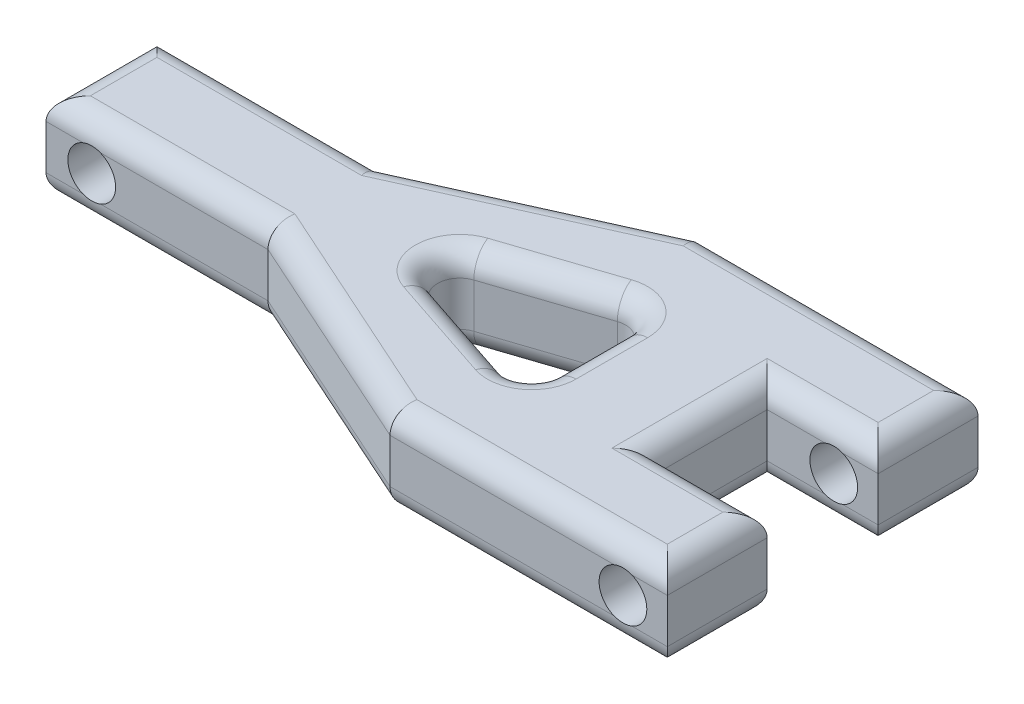
from build123d import *

# Parameters (mm, degrees)
SKETCH1_W           = 65
SKETCH1_H           = 28
BOSS_EXTRUDE1_DEPTH = 8
SKETCH2_W           = 10
SKETCH2_H           = 10
CUT_EXTRUDE1_DEPTH  = 10
SKETCH3_R           = 2.15
CUT_EXTRUDE2_DEPTH  = 48.899263129
SKETCH5_W           = 20.008392886
SKETCH5_H           = 9
CUT_EXTRUDE4_DEPTH  = 42.488060591
FILLET1_R           = 2
SKETCH8_R           = 2.15
CUT_EXTRUDE5_DEPTH  = 44.258980729
CUT_EXTRUDE6_DEPTH  = 10
FILLET2_R           = 2


with BuildPart() as part:
    # Sketch1 → Boss-Extrude1 (new body)
    with BuildSketch(Plane(origin=(0, 0, 0), x_dir=(1, 0, 0), z_dir=(0, 1, 0))):
        with Locations((-5.530769231, -0.523076923)):
            Rectangle(SKETCH1_W, SKETCH1_H)
    extrude(amount=BOSS_EXTRUDE1_DEPTH)

    # Sketch2 → Cut-Extrude1 (cut)
    with BuildSketch(Plane(origin=(0, 8, 0), x_dir=(1, 0, 0), z_dir=(0, 1, 0))):
        with Locations((21.969230769, -0.523076923)):
            Rectangle(SKETCH2_W, SKETCH2_H)
    extrude(amount=-CUT_EXTRUDE1_DEPTH, mode=Mode.SUBTRACT)

    # Sketch3 → Cut-Extrude2 (cut, through all)
    with BuildSketch(Plane.XY.offset(14.523076923)):
        with Locations((22.969230769, 4)):
            Circle(SKETCH3_R)
    extrude(amount=-CUT_EXTRUDE2_DEPTH, mode=Mode.SUBTRACT)

    # Sketch5 → Cut-Extrude4 (cut, through all)
    with BuildSketch(Plane(origin=(0, 8, 0), x_dir=(1, 0, 0), z_dir=(0, 1, 0))):
        with Locations((-28.026572788, 8.976923077)):
            Rectangle(SKETCH5_W, SKETCH5_H)
        Polygon((-18.022376345, 13.476923077), (-18.022376345, 4.476923077), (1.977623655, 13.476923077), align=None)
        Polygon((1.977623655, -14.523076923), (-18.022376345, -5.523076923), (-18.022376345, -14.523076923), align=None)
        with Locations((-28.026572788, -10.023076923)):
            Rectangle(SKETCH5_W, SKETCH5_H)
    extrude(amount=-CUT_EXTRUDE4_DEPTH, mode=Mode.SUBTRACT)

    # Fillet1
    # the kernel refuses this fillet: 2 mm, written as the material it takes off along each edge
    with BuildSketch(Plane(origin=(26.969230769, 0, -18.476923077), x_dir=(-1, 0, 0), z_dir=(0, 0, 1)), Plane(origin=(26.969230769, 0, 0.523076923), x_dir=(-1, 0, 0), z_dir=(0, 0, 1))) as fillet1_piece_1:
        with BuildLine():
            CenterArc((FILLET1_R, -FILLET1_R), FILLET1_R, 90, 90)
            Line((0, -FILLET1_R), (0, 0))
            Line((0, 0), (FILLET1_R, 0))
        make_face()
    extrude(amount=19, mode=Mode.SUBTRACT)
    with BuildSketch(Plane(origin=(16.969230769, 0, -4.476923077), x_dir=(0, 0, -1), z_dir=(1, 0, 0)), Plane(origin=(31.969230769, 0, 5.523076923), x_dir=(0, 0, 1), z_dir=(-1, 0, 0)), Plane(origin=(31.969230769, 8, -4.476923077), x_dir=(0, 0, -1), z_dir=(-1, 0, 0)), Plane(origin=(16.969230769, 8, 5.523076923), x_dir=(0, 0, 1), z_dir=(1, 0, 0))) as fillet1_piece_2:
        with BuildLine():
            CenterArc((FILLET1_R, FILLET1_R), FILLET1_R, 180, 90)
            Line((0, FILLET1_R), (0, 0))
            Line((0, 0), (FILLET1_R, 0))
        make_face()
    extrude(amount=15, mode=Mode.SUBTRACT)
    with BuildSketch(Plane(origin=(16.969230769, 0, 5.523076923), x_dir=(-1, 0, 0), z_dir=(0, 0, -1)), Plane(origin=(16.969230769, 8, -4.476923077), x_dir=(-1, 0, 0), z_dir=(0, 0, 1))) as fillet1_piece_3:
        with BuildLine():
            CenterArc((FILLET1_R, FILLET1_R), FILLET1_R, 180, 90)
            Line((0, FILLET1_R), (0, 0))
            Line((0, 0), (FILLET1_R, 0))
        make_face()
    extrude(amount=10, mode=Mode.SUBTRACT)
    with BuildSketch(Plane(origin=(26.969230769, 8, -18.476923077), x_dir=(-1, 0, 0), z_dir=(0, 0, 1)), Plane(origin=(26.969230769, 8, 0.523076923), x_dir=(-1, 0, 0), z_dir=(0, 0, 1))) as fillet1_piece_4:
        with BuildLine():
            CenterArc((FILLET1_R, FILLET1_R), FILLET1_R, 180, 90)
            Line((0, FILLET1_R), (0, 0))
            Line((0, 0), (FILLET1_R, 0))
        make_face()
    extrude(amount=19, mode=Mode.SUBTRACT)
    with BuildSketch(Plane(origin=(31.969230769, 0, 14.523076923), x_dir=(0, 1, 0), z_dir=(-1, 0, 0)), Plane(origin=(-3.022376345, 8, -13.476923077), x_dir=(0, 0, 1), z_dir=(1, 0, 0))) as fillet1_piece_5:
        with BuildLine():
            CenterArc((FILLET1_R, FILLET1_R), FILLET1_R, 180, 90)
            Line((0, FILLET1_R), (0, 0))
            Line((0, 0), (FILLET1_R, 0))
        make_face()
    extrude(amount=34.991607114, mode=Mode.SUBTRACT)
    with BuildSketch(Plane(origin=(-38.030769231, 0, 10.523076923), x_dir=(1, 0, 0), z_dir=(0, 0, -1))) as fillet1_piece_6:
        with BuildLine():
            CenterArc((FILLET1_R, -FILLET1_R), FILLET1_R, 90, 90)
            Line((0, -FILLET1_R), (0, 0))
            Line((0, 0), (FILLET1_R, 0))
        make_face()
    extrude(amount=20, mode=Mode.SUBTRACT)
    with BuildSketch(Plane(origin=(-38.030769231, 8, 10.523076923), x_dir=(1, 0, 0), z_dir=(0, 0, -1))) as fillet1_piece_7:
        with BuildLine():
            CenterArc((FILLET1_R, FILLET1_R), FILLET1_R, 180, 90)
            Line((0, FILLET1_R), (0, 0))
            Line((0, 0), (FILLET1_R, 0))
        make_face()
    extrude(amount=20, mode=Mode.SUBTRACT)
    with BuildSketch(Plane(origin=(31.969230769, 8, 14.523076923), x_dir=(0, -1, 0), z_dir=(-1, 0, 0)), Plane(origin=(-3.022376345, 0, -13.476923077), x_dir=(0, 0, 1), z_dir=(1, 0, 0))) as fillet1_piece_8:
        with BuildLine():
            CenterArc((FILLET1_R, -FILLET1_R), FILLET1_R, 90, 90)
            Line((0, -FILLET1_R), (0, 0))
            Line((0, 0), (FILLET1_R, 0))
        make_face()
    extrude(amount=34.991607114, mode=Mode.SUBTRACT)
    with BuildSketch(Plane(origin=(-13.022376345, 0, -4.476923077), x_dir=(0, 0, 1), z_dir=(-1, 0, 0))) as fillet1_piece_9_section:
        with BuildLine():
            CenterArc((FILLET1_R, FILLET1_R), FILLET1_R, 180, 90)
            Line((0, FILLET1_R), (0, 0))
            Line((0, 0), (FILLET1_R, 0))
        make_face()
    fillet1_piece_9 = extrude(amount=30.008392886, mode=Mode.PRIVATE)
    fillet1_piece_9 = split(fillet1_piece_9, bisect_by=Plane(origin=(-28.986353443, 0.462958452, 0.456866617), z_dir=(-0.4103646773287979, 0, -0.9119215051751064)), keep=Keep.TOP, mode=Mode.PRIVATE)
    add(fillet1_piece_9, mode=Mode.SUBTRACT)
    with BuildSketch(Plane(origin=(6.537231181, 0, -15.528746464), x_dir=(0.41036467732879783, 0, 0.9119215051751064), z_dir=(-0.9119215051751064, 0, 0.4103646773287979))) as fillet1_piece_10_section:
        with BuildLine():
            CenterArc((FILLET1_R, FILLET1_R), FILLET1_R, 180, 90)
            Line((0, FILLET1_R), (0, 0))
            Line((0, 0), (FILLET1_R, 0))
        make_face()
    fillet1_piece_10 = extrude(amount=31.931712199, mode=Mode.PRIVATE)
    fillet1_piece_10 = split(fillet1_piece_10, bisect_by=Plane(origin=(-5.120660907, 0.462204108, -4.476923077), z_dir=(0, 0, -1)), keep=Keep.TOP, mode=Mode.PRIVATE)
    add(fillet1_piece_10, mode=Mode.SUBTRACT)
    with BuildSketch(Plane(origin=(-43.030769231, 8, -4.476923077), x_dir=(0, 0, 1), z_dir=(1, 0, 0))) as fillet1_piece_11_section:
        with BuildLine():
            CenterArc((FILLET1_R, FILLET1_R), FILLET1_R, 180, 90)
            Line((0, FILLET1_R), (0, 0))
            Line((0, 0), (FILLET1_R, 0))
        make_face()
    fillet1_piece_11 = extrude(amount=30.008392886, mode=Mode.PRIVATE)
    fillet1_piece_11 = split(fillet1_piece_11, bisect_by=Plane(origin=(-28.986353443, 7.537041548, 0.456866617), z_dir=(-0.4103646773287979, 0, -0.9119215051751064)), keep=Keep.TOP, mode=Mode.PRIVATE)
    add(fillet1_piece_11, mode=Mode.SUBTRACT)
    with BuildSketch(Plane(origin=(-22.581983871, 8, -2.42509969), x_dir=(0.4103646773287979, 0, 0.9119215051751064), z_dir=(0.9119215051751064, 0, -0.4103646773287979))) as fillet1_piece_12_section:
        with BuildLine():
            CenterArc((FILLET1_R, FILLET1_R), FILLET1_R, 180, 90)
            Line((0, FILLET1_R), (0, 0))
            Line((0, 0), (FILLET1_R, 0))
        make_face()
    fillet1_piece_12 = extrude(amount=31.931712199, mode=Mode.PRIVATE)
    fillet1_piece_12 = split(fillet1_piece_12, bisect_by=Plane(origin=(-5.120660907, 7.537795892, -4.476923077), z_dir=(0, 0, -1)), keep=Keep.TOP, mode=Mode.PRIVATE)
    add(fillet1_piece_12, mode=Mode.SUBTRACT)
    with BuildSketch(Plane(origin=(6.537231181, 8, 16.57490031), x_dir=(0, -1, 0), z_dir=(-0.9119215051751064, 0, -0.41036467732879806))) as fillet1_piece_13_section:
        with BuildLine():
            CenterArc((FILLET1_R, -FILLET1_R), FILLET1_R, 90, 90)
            Line((0, -FILLET1_R), (0, 0))
            Line((0, 0), (FILLET1_R, 0))
        make_face()
    fillet1_piece_13 = extrude(amount=31.931712199, mode=Mode.PRIVATE)
    fillet1_piece_13 = split(fillet1_piece_13, bisect_by=Plane(origin=(-5.120660907, 7.537795892, 5.523076923), z_dir=(0, 0, 1)), keep=Keep.TOP, mode=Mode.PRIVATE)
    add(fillet1_piece_13, mode=Mode.SUBTRACT)
    with BuildSketch(Plane(origin=(-13.022376345, 8, 5.523076923), x_dir=(0, 0, -1), z_dir=(-1, 0, 0))) as fillet1_piece_14_section:
        with BuildLine():
            CenterArc((FILLET1_R, FILLET1_R), FILLET1_R, 180, 90)
            Line((0, FILLET1_R), (0, 0))
            Line((0, 0), (FILLET1_R, 0))
        make_face()
    fillet1_piece_14 = extrude(amount=30.008392886, mode=Mode.PRIVATE)
    fillet1_piece_14 = split(fillet1_piece_14, bisect_by=Plane(origin=(-28.986353443, 7.537041548, 0.589287229), z_dir=(-0.41036467732879806, 0, 0.9119215051751064)), keep=Keep.TOP, mode=Mode.PRIVATE)
    add(fillet1_piece_14, mode=Mode.SUBTRACT)
    with BuildSketch(Plane(origin=(-22.581983871, 0, 3.471253536), x_dir=(0.41036467732879806, 0, -0.9119215051751064), z_dir=(0.9119215051751064, 0, 0.41036467732879806))) as fillet1_piece_15_section:
        with BuildLine():
            CenterArc((FILLET1_R, FILLET1_R), FILLET1_R, 180, 90)
            Line((0, FILLET1_R), (0, 0))
            Line((0, 0), (FILLET1_R, 0))
        make_face()
    fillet1_piece_15 = extrude(amount=31.931712199, mode=Mode.PRIVATE)
    fillet1_piece_15 = split(fillet1_piece_15, bisect_by=Plane(origin=(-5.120660907, 0.462204108, 5.523076923), z_dir=(0, 0, 1)), keep=Keep.TOP, mode=Mode.PRIVATE)
    add(fillet1_piece_15, mode=Mode.SUBTRACT)
    with BuildSketch(Plane(origin=(-43.030769231, 0, 5.523076923), x_dir=(0, 0, -1), z_dir=(1, 0, 0))) as fillet1_piece_16_section:
        with BuildLine():
            CenterArc((FILLET1_R, FILLET1_R), FILLET1_R, 180, 90)
            Line((0, FILLET1_R), (0, 0))
            Line((0, 0), (FILLET1_R, 0))
        make_face()
    fillet1_piece_16 = extrude(amount=30.008392886, mode=Mode.PRIVATE)
    fillet1_piece_16 = split(fillet1_piece_16, bisect_by=Plane(origin=(-28.986353443, 0.462958452, 0.589287229), z_dir=(-0.41036467732879806, 0, 0.9119215051751064)), keep=Keep.TOP, mode=Mode.PRIVATE)
    add(fillet1_piece_16, mode=Mode.SUBTRACT)
    with BuildSketch(Plane(origin=(16.969230769, 0, 5.523076923), x_dir=(-1, 0, 0), z_dir=(0, 0, -1))) as fillet1_piece_17a_section:
        with BuildLine():
            CenterArc((FILLET1_R, FILLET1_R), FILLET1_R, 180, 90)
            Line((0, FILLET1_R), (0, 0))
            Line((0, 0), (FILLET1_R, 0))
        make_face()
    fillet1_piece_17a = extrude(amount=15, mode=Mode.PRIVATE)
    fillet1_piece_17a = split(fillet1_piece_17a, bisect_by=Plane(origin=(16.516440541, 0.452790229, -4.476923077), z_dir=(0, 0, -1)), keep=Keep.TOP, mode=Mode.PRIVATE)
    with BuildSketch(Plane(origin=(11.969230769, 0, -4.476923077), x_dir=(0, 0, -1), z_dir=(1, 0, 0))) as fillet1_piece_17b_section:
        with BuildLine():
            CenterArc((FILLET1_R, FILLET1_R), FILLET1_R, 180, 90)
            Line((0, FILLET1_R), (0, 0))
            Line((0, 0), (FILLET1_R, 0))
        make_face()
    fillet1_piece_17b = extrude(amount=20, mode=Mode.PRIVATE)
    fillet1_piece_17b = split(fillet1_piece_17b, bisect_by=Plane(origin=(16.969230769, 0.452790229, -4.929713305), z_dir=(-1, 0, 0)), keep=Keep.TOP, mode=Mode.PRIVATE)
    fillet1_piece_17 = fillet1_piece_17a & fillet1_piece_17b
    add(fillet1_piece_17, mode=Mode.SUBTRACT)
    with BuildSketch(Plane(origin=(31.969230769, 0, 5.523076923), x_dir=(0, 0, 1), z_dir=(-1, 0, 0))) as fillet1_piece_18a_section:
        with BuildLine():
            CenterArc((FILLET1_R, FILLET1_R), FILLET1_R, 180, 90)
            Line((0, FILLET1_R), (0, 0))
            Line((0, 0), (FILLET1_R, 0))
        make_face()
    fillet1_piece_18a = extrude(amount=20, mode=Mode.PRIVATE)
    fillet1_piece_18a = split(fillet1_piece_18a, bisect_by=Plane(origin=(16.969230769, 0.452790229, 5.975867152), z_dir=(-1, 0, 0)), keep=Keep.TOP, mode=Mode.PRIVATE)
    with BuildSketch(Plane(origin=(16.969230769, 0, 10.523076923), x_dir=(-1, 0, 0), z_dir=(0, 0, -1))) as fillet1_piece_18b_section:
        with BuildLine():
            CenterArc((FILLET1_R, FILLET1_R), FILLET1_R, 180, 90)
            Line((0, FILLET1_R), (0, 0))
            Line((0, 0), (FILLET1_R, 0))
        make_face()
    fillet1_piece_18b = extrude(amount=15, mode=Mode.PRIVATE)
    fillet1_piece_18b = split(fillet1_piece_18b, bisect_by=Plane(origin=(16.516440541, 0.452790229, 5.523076923), z_dir=(0, 0, 1)), keep=Keep.TOP, mode=Mode.PRIVATE)
    fillet1_piece_18 = fillet1_piece_18a & fillet1_piece_18b
    add(fillet1_piece_18, mode=Mode.SUBTRACT)
    with BuildSketch(Plane(origin=(16.969230769, 8, -9.476923077), x_dir=(-1, 0, 0), z_dir=(0, 0, 1))) as fillet1_piece_19a_section:
        with BuildLine():
            CenterArc((FILLET1_R, FILLET1_R), FILLET1_R, 180, 90)
            Line((0, FILLET1_R), (0, 0))
            Line((0, 0), (FILLET1_R, 0))
        make_face()
    fillet1_piece_19a = extrude(amount=15, mode=Mode.PRIVATE)
    fillet1_piece_19a = split(fillet1_piece_19a, bisect_by=Plane(origin=(16.516440541, 7.547209771, -4.476923077), z_dir=(0, 0, -1)), keep=Keep.TOP, mode=Mode.PRIVATE)
    with BuildSketch(Plane(origin=(31.969230769, 8, -4.476923077), x_dir=(0, 0, -1), z_dir=(-1, 0, 0))) as fillet1_piece_19b_section:
        with BuildLine():
            CenterArc((FILLET1_R, FILLET1_R), FILLET1_R, 180, 90)
            Line((0, FILLET1_R), (0, 0))
            Line((0, 0), (FILLET1_R, 0))
        make_face()
    fillet1_piece_19b = extrude(amount=20, mode=Mode.PRIVATE)
    fillet1_piece_19b = split(fillet1_piece_19b, bisect_by=Plane(origin=(16.969230769, 7.547209771, -4.929713305), z_dir=(-1, 0, 0)), keep=Keep.TOP, mode=Mode.PRIVATE)
    fillet1_piece_19 = fillet1_piece_19a & fillet1_piece_19b
    add(fillet1_piece_19, mode=Mode.SUBTRACT)
    with BuildSketch(Plane(origin=(11.969230769, 8, 5.523076923), x_dir=(0, 0, 1), z_dir=(1, 0, 0))) as fillet1_piece_20a_section:
        with BuildLine():
            CenterArc((FILLET1_R, FILLET1_R), FILLET1_R, 180, 90)
            Line((0, FILLET1_R), (0, 0))
            Line((0, 0), (FILLET1_R, 0))
        make_face()
    fillet1_piece_20a = extrude(amount=20, mode=Mode.PRIVATE)
    fillet1_piece_20a = split(fillet1_piece_20a, bisect_by=Plane(origin=(16.969230769, 7.547209771, 5.975867152), z_dir=(-1, 0, 0)), keep=Keep.TOP, mode=Mode.PRIVATE)
    with BuildSketch(Plane(origin=(16.969230769, 8, -4.476923077), x_dir=(-1, 0, 0), z_dir=(0, 0, 1))) as fillet1_piece_20b_section:
        with BuildLine():
            CenterArc((FILLET1_R, FILLET1_R), FILLET1_R, 180, 90)
            Line((0, FILLET1_R), (0, 0))
            Line((0, 0), (FILLET1_R, 0))
        make_face()
    fillet1_piece_20b = extrude(amount=15, mode=Mode.PRIVATE)
    fillet1_piece_20b = split(fillet1_piece_20b, bisect_by=Plane(origin=(16.516440541, 7.547209771, 5.523076923), z_dir=(0, 0, 1)), keep=Keep.TOP, mode=Mode.PRIVATE)
    fillet1_piece_20 = fillet1_piece_20a & fillet1_piece_20b
    add(fillet1_piece_20, mode=Mode.SUBTRACT)
    with BuildSketch(Plane(origin=(6.537231181, 0, -15.528746464), x_dir=(0.41036467732879783, 0, 0.9119215051751064), z_dir=(-0.9119215051751064, 0, 0.4103646773287979))) as fillet1_piece_21a_section:
        with BuildLine():
            CenterArc((FILLET1_R, FILLET1_R), FILLET1_R, 180, 90)
            Line((0, FILLET1_R), (0, 0))
            Line((0, 0), (FILLET1_R, 0))
        make_face()
    fillet1_piece_21a = extrude(amount=31.931712199, mode=Mode.PRIVATE)
    fillet1_piece_21a = split(fillet1_piece_21a, bisect_by=Plane(origin=(-19.559662553, 0.412155613, -4.476923077), z_dir=(0, 0, 1)), keep=Keep.TOP, mode=Mode.PRIVATE)
    with BuildSketch(Plane(origin=(-13.022376345, 0, -4.476923077), x_dir=(0, 0, 1), z_dir=(-1, 0, 0))) as fillet1_piece_21b_section:
        with BuildLine():
            CenterArc((FILLET1_R, FILLET1_R), FILLET1_R, 180, 90)
            Line((0, FILLET1_R), (0, 0))
            Line((0, 0), (FILLET1_R, 0))
        make_face()
    fillet1_piece_21b = extrude(amount=30.008392886, mode=Mode.PRIVATE)
    fillet1_piece_21b = split(fillet1_piece_21b, bisect_by=Plane(origin=(-16.620491992, 0.412155613, -5.107771036), z_dir=(0.4103646773287979, 0, 0.9119215051751064)), keep=Keep.TOP, mode=Mode.PRIVATE)
    fillet1_piece_21 = fillet1_piece_21a & fillet1_piece_21b
    add(fillet1_piece_21, mode=Mode.SUBTRACT)
    with BuildSketch(Plane(origin=(-22.581983871, 8, -2.42509969), x_dir=(0.4103646773287979, 0, 0.9119215051751064), z_dir=(0.9119215051751064, 0, -0.4103646773287979))) as fillet1_piece_22a_section:
        with BuildLine():
            CenterArc((FILLET1_R, FILLET1_R), FILLET1_R, 180, 90)
            Line((0, FILLET1_R), (0, 0))
            Line((0, 0), (FILLET1_R, 0))
        make_face()
    fillet1_piece_22a = extrude(amount=31.931712199, mode=Mode.PRIVATE)
    fillet1_piece_22a = split(fillet1_piece_22a, bisect_by=Plane(origin=(-19.559662553, 7.587844387, -4.476923077), z_dir=(0, 0, 1)), keep=Keep.TOP, mode=Mode.PRIVATE)
    with BuildSketch(Plane(origin=(-43.030769231, 8, -4.476923077), x_dir=(0, 0, 1), z_dir=(1, 0, 0))) as fillet1_piece_22b_section:
        with BuildLine():
            CenterArc((FILLET1_R, FILLET1_R), FILLET1_R, 180, 90)
            Line((0, FILLET1_R), (0, 0))
            Line((0, 0), (FILLET1_R, 0))
        make_face()
    fillet1_piece_22b = extrude(amount=30.008392886, mode=Mode.PRIVATE)
    fillet1_piece_22b = split(fillet1_piece_22b, bisect_by=Plane(origin=(-16.620491992, 7.587844387, -5.107771036), z_dir=(0.4103646773287979, 0, 0.9119215051751064)), keep=Keep.TOP, mode=Mode.PRIVATE)
    fillet1_piece_22 = fillet1_piece_22a & fillet1_piece_22b
    add(fillet1_piece_22, mode=Mode.SUBTRACT)
    with BuildSketch(Plane(origin=(6.537231181, 8, 16.57490031), x_dir=(0, -1, 0), z_dir=(-0.9119215051751064, 0, -0.41036467732879806))) as fillet1_piece_23a_section:
        with BuildLine():
            CenterArc((FILLET1_R, -FILLET1_R), FILLET1_R, 90, 90)
            Line((0, -FILLET1_R), (0, 0))
            Line((0, 0), (FILLET1_R, 0))
        make_face()
    fillet1_piece_23a = extrude(amount=31.931712199, mode=Mode.PRIVATE)
    fillet1_piece_23a = split(fillet1_piece_23a, bisect_by=Plane(origin=(-19.559662553, 7.587844387, 5.523076923), z_dir=(0, 0, -1)), keep=Keep.TOP, mode=Mode.PRIVATE)
    with BuildSketch(Plane(origin=(-13.022376345, 8, 5.523076923), x_dir=(0, 0, -1), z_dir=(-1, 0, 0))) as fillet1_piece_23b_section:
        with BuildLine():
            CenterArc((FILLET1_R, FILLET1_R), FILLET1_R, 180, 90)
            Line((0, FILLET1_R), (0, 0))
            Line((0, 0), (FILLET1_R, 0))
        make_face()
    fillet1_piece_23b = extrude(amount=30.008392886, mode=Mode.PRIVATE)
    fillet1_piece_23b = split(fillet1_piece_23b, bisect_by=Plane(origin=(-16.620491992, 7.587844387, 6.153924882), z_dir=(0.41036467732879806, 0, -0.9119215051751064)), keep=Keep.TOP, mode=Mode.PRIVATE)
    fillet1_piece_23 = fillet1_piece_23a & fillet1_piece_23b
    add(fillet1_piece_23, mode=Mode.SUBTRACT)
    with BuildSketch(Plane(origin=(-43.030769231, 0, 5.523076923), x_dir=(0, 0, -1), z_dir=(1, 0, 0))) as fillet1_piece_24a_section:
        with BuildLine():
            CenterArc((FILLET1_R, FILLET1_R), FILLET1_R, 180, 90)
            Line((0, FILLET1_R), (0, 0))
            Line((0, 0), (FILLET1_R, 0))
        make_face()
    fillet1_piece_24a = extrude(amount=30.008392886, mode=Mode.PRIVATE)
    fillet1_piece_24a = split(fillet1_piece_24a, bisect_by=Plane(origin=(-16.620491992, 0.412155613, 6.153924882), z_dir=(0.41036467732879806, 0, -0.9119215051751064)), keep=Keep.TOP, mode=Mode.PRIVATE)
    with BuildSketch(Plane(origin=(-22.581983871, 0, 3.471253536), x_dir=(0.41036467732879806, 0, -0.9119215051751064), z_dir=(0.9119215051751064, 0, 0.41036467732879806))) as fillet1_piece_24b_section:
        with BuildLine():
            CenterArc((FILLET1_R, FILLET1_R), FILLET1_R, 180, 90)
            Line((0, FILLET1_R), (0, 0))
            Line((0, 0), (FILLET1_R, 0))
        make_face()
    fillet1_piece_24b = extrude(amount=31.931712199, mode=Mode.PRIVATE)
    fillet1_piece_24b = split(fillet1_piece_24b, bisect_by=Plane(origin=(-19.559662553, 0.412155613, 5.523076923), z_dir=(0, 0, -1)), keep=Keep.TOP, mode=Mode.PRIVATE)
    fillet1_piece_24 = fillet1_piece_24a & fillet1_piece_24b
    add(fillet1_piece_24, mode=Mode.SUBTRACT)

    # Sketch8 → Cut-Extrude5 (cut, through all)
    with BuildSketch(Plane(origin=(0, 0, -4.476923077), x_dir=(-1, 0, 0), z_dir=(0, 0, -1))):
        with Locations(Location((33.909652253, 4, 0), (0, 0, 68.471095594))):
            Circle(SKETCH8_R)
    extrude(amount=-CUT_EXTRUDE5_DEPTH, mode=Mode.SUBTRACT)

    # Sketch9 → Cut-Extrude6 (cut)
    with BuildSketch(Plane(origin=(0, 8, 0), x_dir=(1, 0, 0), z_dir=(0, 1, 0))):
        Polygon((-12.075489078, -0.523076923), (5.969230769, -6.523076923), (5.969230769, 5.476923077), align=None)
    extrude(amount=-CUT_EXTRUDE6_DEPTH, mode=Mode.SUBTRACT)

    # Fillet2
    fillet2_edges = [part.edges().sort_by_distance(p)[0] for p in [
        (-3.053129155, 0, 3.523076923),
        (5.969230769, 0, 0.523076923),
        (-3.053129155, 0, -2.476923077),
        (-12.075489078, 4, 0.523076923),
        (5.969230769, 4, -5.476923077),
        (5.969230769, 4, 6.523076923),
        (-3.053129155, 8, -2.476923077),
        (-3.053129155, 8, 3.523076923),
        (5.969230769, 8, 0.523076923),
    ]]
    fillet(fillet2_edges, radius=FILLET2_R)


solid = part.part
